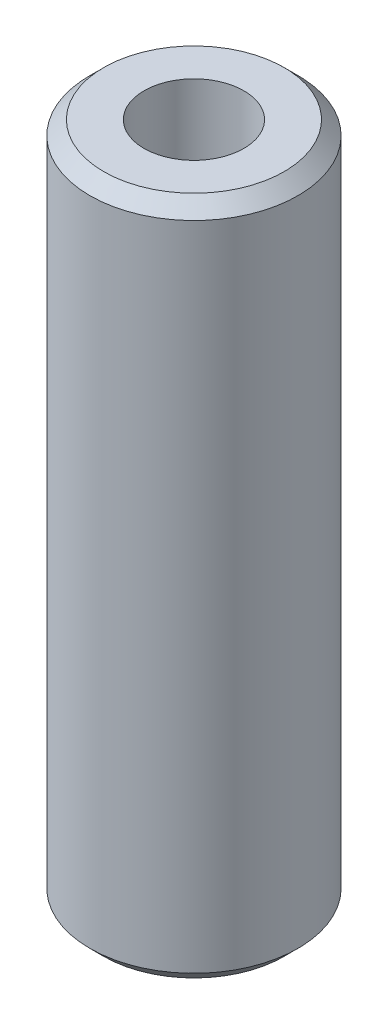
from build123d import *

# Parameters (mm, degrees)
SKETCH1_R           = 45
BOSS_EXTRUDE1_DEPTH = 293.887048248
SKETCH2_R           = 21.60783206
CUT_EXTRUDE1_DEPTH  = 301.69851534
CHAMFER1_SIZE       = 5.990914718


with BuildPart() as part:
    # Sketch1 → Boss-Extrude1 (new body)
    with BuildSketch(Plane(origin=(0, 0, 0), x_dir=(1, 0, 0), z_dir=(0, 1, 0))):
        Circle(SKETCH1_R)
    extrude(amount=BOSS_EXTRUDE1_DEPTH)

    # Sketch2 → Cut-Extrude1 (cut, through all)
    with BuildSketch(Plane(origin=(0, 0, 0), x_dir=(1, 0, 0), z_dir=(0, 1, 0))):
        Circle(SKETCH2_R)
    extrude(amount=CUT_EXTRUDE1_DEPTH, mode=Mode.SUBTRACT)

    # Chamfer1
    chamfer1_edges = [part.edges().sort_by_distance(p)[0] for p in [
        (-45, 293.887048248, 0),
        (-45, 0, 0),
    ]]
    chamfer(chamfer1_edges, length=CHAMFER1_SIZE)


solid = part.part
